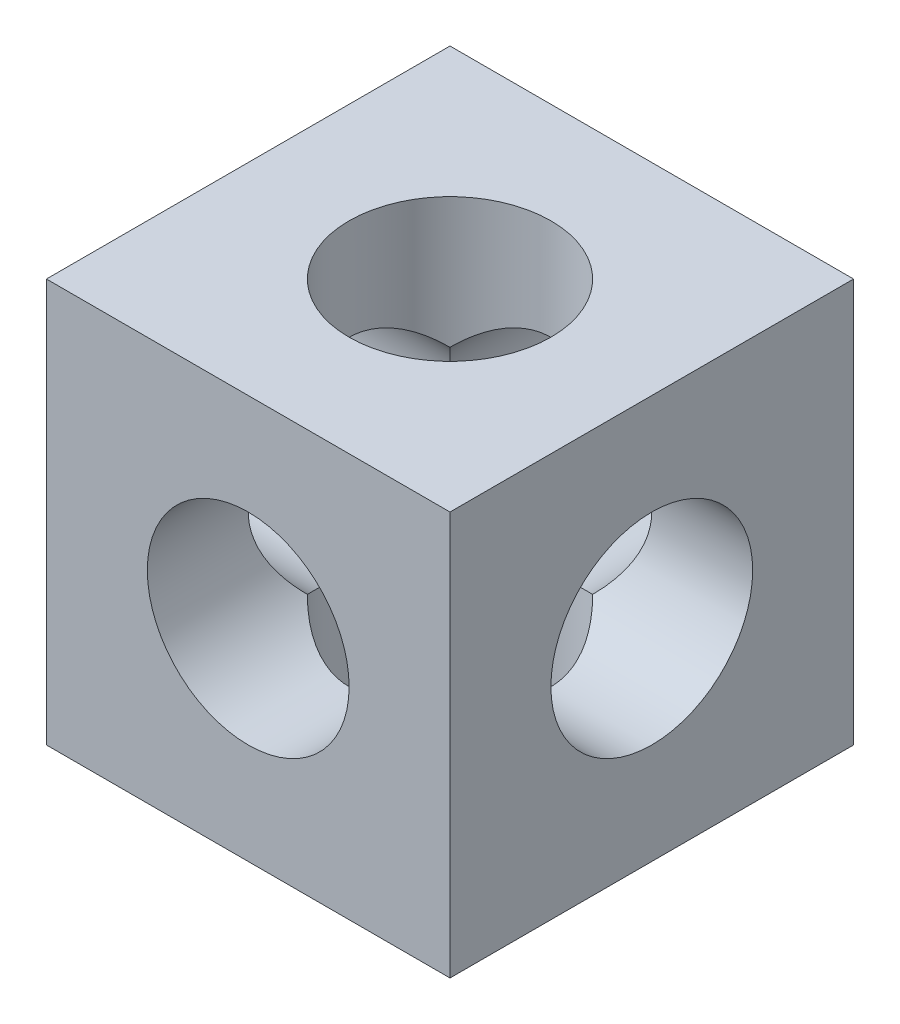
from build123d import *

# Parameters (mm, degrees)
SKETCH1_W           = 50.8
SKETCH1_H           = 50.8
BOSS_EXTRUDE1_DEPTH = 25.4
SKETCH2_R           = 12.7
CUT_EXTRUDE1_DEPTH  = 63.217039467
SKETCH3_R           = 12.7
CUT_EXTRUDE2_DEPTH  = 63.217039467
SKETCH4_R           = 12.7
CUT_EXTRUDE3_DEPTH  = 63.217039467


with BuildPart() as part:
    # Sketch1 → Boss-Extrude1 (new, symmetric)
    with BuildSketch(Plane(origin=(0, 0, 0), x_dir=(1, 0, 0), z_dir=(0, 1, 0))):
        Rectangle(SKETCH1_W, SKETCH1_H)
    extrude(amount=BOSS_EXTRUDE1_DEPTH, both=True)

    # Sketch2 → Cut-Extrude1 (cut, through all)
    with BuildSketch(Plane.XY.offset(25.4)):
        Circle(SKETCH2_R)
    extrude(amount=-CUT_EXTRUDE1_DEPTH, mode=Mode.SUBTRACT)

    # Sketch3 → Cut-Extrude2 (cut, through all)
    with BuildSketch(Plane(origin=(25.4, 0, 0), x_dir=(0, 0, -1), z_dir=(1, 0, 0))):
        Circle(SKETCH3_R)
    extrude(amount=-CUT_EXTRUDE2_DEPTH, mode=Mode.SUBTRACT)

    # Sketch4 → Cut-Extrude3 (cut, through all)
    with BuildSketch(Plane(origin=(0, 25.4, 0), x_dir=(1, 0, 0), z_dir=(0, 1, 0))):
        Circle(SKETCH4_R)
    extrude(amount=-CUT_EXTRUDE3_DEPTH, mode=Mode.SUBTRACT)


solid = part.part
